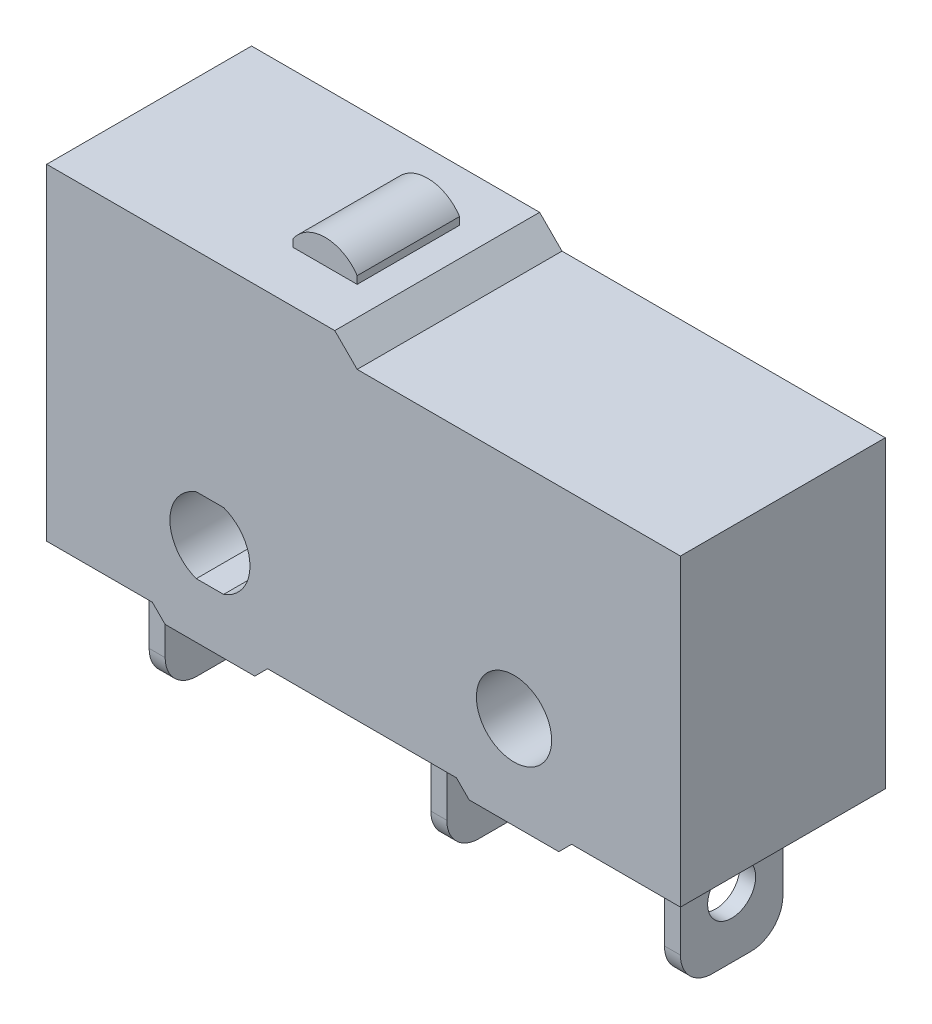
from build123d import *

# Parameters (mm, degrees)
CUT_EXTRUDE1_START       = -3.2
CUT_EXTRUDE1_OUTLINE_R   = 1.175
CUT_EXTRUDE1_DEPTH       = 6.4
CUT_EXTRUDE1_START_2     = -1.6
CUT_EXTRUDE1_2_OUTLINE_W = 0.5
CUT_EXTRUDE1_2_OUTLINE_H = 3.9
CUT_EXTRUDE1_2_DEPTH     = 0.8499999
CUT_EXTRUDE1_START_3     = 0.7500001
CUT_EXTRUDE1_3_OUTLINE_W = 0.5
CUT_EXTRUDE1_3_OUTLINE_H = 3.9
CUT_EXTRUDE1_3_DEPTH     = 0.8499999
CUT_EXTRUDE1_4_DEPTH     = 3.2
CUT_EXTRUDE1_START_4     = -13
CUT_EXTRUDE1_5_DEPTH     = 0.5
CUT_EXTRUDE1_START_5     = -4.2
CUT_EXTRUDE1_6_DEPTH     = 0.5
CUT_EXTRUDE1_START_6     = 3.1
CUT_EXTRUDE1_7_DEPTH     = 0.5
FILLET1_R                = 1


with BuildPart() as part:
    # Cut-Extrude1: read off the stored shape, not the designer's step
    # Cut-Extrude1 outline → Cut-Extrude1 (new body)
    with BuildSketch(Plane.XY.offset(CUT_EXTRUDE1_START)):
        Polygon((-14.6, -2.5), (-11.3, -2.5), (-10.9, -2.9), (-8.1, -2.9), (-7.7, -2.5), (-1.8, -2.5), (-1.4, -2.9), (1.4, -2.9), (1.8, -2.5), (5.2, -2.5), (5.2, 7), (-4.9, 7), (-5.6, 7.7), (-14.6, 7.7), align=None)
        with BuildLine():
            ThreePointArc((-9.926468053, -1.175), (-10.75, 0), (-9.926468053, 1.175))
            Line((-9.926468053, 1.175), (-9.073531947, 1.175))
            ThreePointArc((-9.073531947, 1.175), (-8.25, 0), (-9.073531947, -1.175))
            Line((-9.073531947, -1.175), (-9.926468053, -1.175))
        make_face(mode=Mode.SUBTRACT)
        Circle(CUT_EXTRUDE1_OUTLINE_R, mode=Mode.SUBTRACT)
    extrude(amount=CUT_EXTRUDE1_DEPTH)

    # Cut-Extrude1 2 outline → Cut-Extrude1 2 (add)
    with BuildSketch(Plane.XY.offset(CUT_EXTRUDE1_START_2)):
        with Locations((-12.75, -4.45)):
            Rectangle(CUT_EXTRUDE1_2_OUTLINE_W, CUT_EXTRUDE1_2_OUTLINE_H)
        with Locations((-3.95, -4.45)):
            Rectangle(CUT_EXTRUDE1_2_OUTLINE_W, CUT_EXTRUDE1_2_OUTLINE_H)
        with BuildLine():
            Line((-8.5, 7.936178156), (-8.5, 7.7))
            Line((-8.5, 7.7), (-6.5, 7.7))
            Line((-6.5, 7.7), (-6.5, 7.936178156))
            ThreePointArc((-6.5, 7.936178156), (-7.5, 8.472853198), (-8.5, 7.936178156))
        make_face()
        with Locations((3.35, -4.45)):
            Rectangle(CUT_EXTRUDE1_2_OUTLINE_W, CUT_EXTRUDE1_2_OUTLINE_H)
    extrude(amount=CUT_EXTRUDE1_2_DEPTH)

    # Cut-Extrude1 3 outline → Cut-Extrude1 3 (add)
    with BuildSketch(Plane.XY.offset(CUT_EXTRUDE1_START_3)):
        with Locations((-12.75, -4.45)):
            Rectangle(CUT_EXTRUDE1_3_OUTLINE_W, CUT_EXTRUDE1_3_OUTLINE_H)
        with Locations((-3.95, -4.45)):
            Rectangle(CUT_EXTRUDE1_3_OUTLINE_W, CUT_EXTRUDE1_3_OUTLINE_H)
        with BuildLine():
            Line((-8.5, 7.936178156), (-8.5, 7.7))
            Line((-8.5, 7.7), (-6.5, 7.7))
            Line((-6.5, 7.7), (-6.5, 7.936178156))
            ThreePointArc((-6.5, 7.936178156), (-7.5, 8.472853198), (-8.5, 7.936178156))
        make_face()
        with Locations((3.35, -4.45)):
            Rectangle(CUT_EXTRUDE1_3_OUTLINE_W, CUT_EXTRUDE1_3_OUTLINE_H)
    extrude(amount=CUT_EXTRUDE1_3_DEPTH)

    # Cut-Extrude1 4 outline → Cut-Extrude1 4 (add)
    with BuildSketch(Plane.XY.offset(CUT_EXTRUDE1_START_2)):
        with BuildLine():
            Line((-8.5, 7.936178156), (-8.5, 7.7))
            Line((-8.5, 7.7), (-6.5, 7.7))
            Line((-6.5, 7.7), (-6.5, 7.936178156))
            ThreePointArc((-6.5, 7.936178156), (-7.5, 8.472853198), (-8.5, 7.936178156))
        make_face()
    extrude(amount=CUT_EXTRUDE1_4_DEPTH)

    # Cut-Extrude1 5 outline → Cut-Extrude1 5 (add)
    with BuildSketch(Plane.YZ.offset(CUT_EXTRUDE1_START_4)):
        with BuildLine():
            Line((-4.45, 0.75), (-6.4, 0.7500001))
            Line((-6.4, 0.7500001), (-6.4, -0.7500001))
            Line((-6.4, -0.7500001), (-4.45, -0.75))
            ThreePointArc((-4.45, -0.75), (-5.2, 0), (-4.45, 0.75))
        make_face()
        with BuildLine():
            Line((-2.5, 0.7500001), (-4.45, 0.75))
            ThreePointArc((-4.45, 0.75), (-3.7, 0), (-4.45, -0.75))
            Line((-4.45, -0.75), (-2.5, -0.7500001))
            Line((-2.5, -0.7500001), (-2.5, 0.7500001))
        make_face()
    extrude(amount=CUT_EXTRUDE1_5_DEPTH)

    # Cut-Extrude1 6 outline → Cut-Extrude1 6 (add)
    with BuildSketch(Plane.YZ.offset(CUT_EXTRUDE1_START_5)):
        with BuildLine():
            Line((-4.45, 0.75), (-6.4, 0.7500001))
            Line((-6.4, 0.7500001), (-6.4, -0.7500001))
            Line((-6.4, -0.7500001), (-4.45, -0.75))
            ThreePointArc((-4.45, -0.75), (-5.2, 0), (-4.45, 0.75))
        make_face()
        with BuildLine():
            Line((-2.5, 0.7500001), (-4.45, 0.75))
            ThreePointArc((-4.45, 0.75), (-3.7, 0), (-4.45, -0.75))
            Line((-4.45, -0.75), (-2.5, -0.7500001))
            Line((-2.5, -0.7500001), (-2.5, 0.7500001))
        make_face()
    extrude(amount=CUT_EXTRUDE1_6_DEPTH)

    # Cut-Extrude1 7 outline → Cut-Extrude1 7 (add)
    with BuildSketch(Plane.YZ.offset(CUT_EXTRUDE1_START_6)):
        with BuildLine():
            Line((-4.45, 0.75), (-6.4, 0.7500001))
            Line((-6.4, 0.7500001), (-6.4, -0.7500001))
            Line((-6.4, -0.7500001), (-4.45, -0.75))
            ThreePointArc((-4.45, -0.75), (-5.2, 0), (-4.45, 0.75))
        make_face()
        with BuildLine():
            Line((-2.5, 0.7500001), (-4.45, 0.75))
            ThreePointArc((-4.45, 0.75), (-3.7, 0), (-4.45, -0.75))
            Line((-4.45, -0.75), (-2.5, -0.7500001))
            Line((-2.5, -0.7500001), (-2.5, 0.7500001))
        make_face()
    extrude(amount=CUT_EXTRUDE1_7_DEPTH)

    # Fillet1
    fillet1_edges = [part.edges().sort_by_distance(p)[0] for p in [
        (-12.75, -6.4, 1.6),
        (-12.75, -6.4, -1.6),
        (-3.95, -6.4, -1.6),
        (-3.95, -6.4, 1.6),
        (3.35, -6.4, -1.6),
        (3.35, -6.4, 1.6),
    ]]
    fillet(fillet1_edges, radius=FILLET1_R)


solid = part.part
